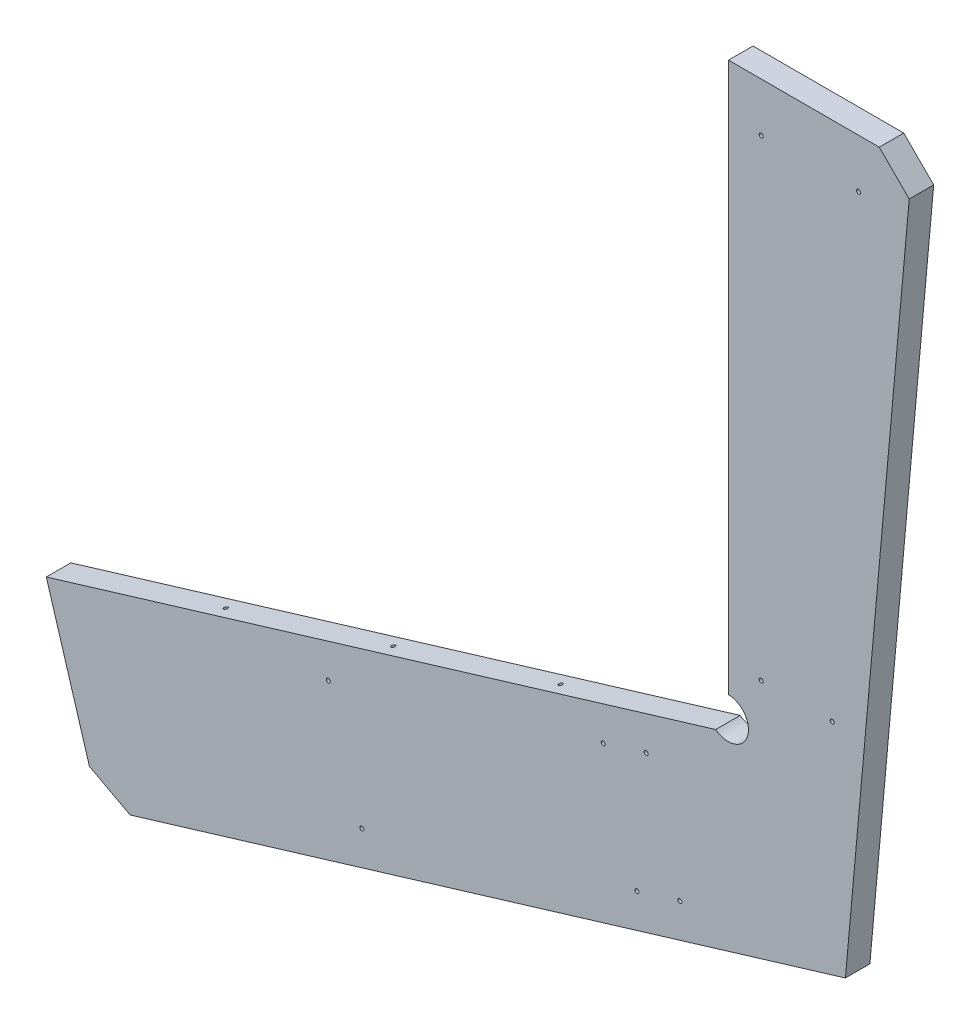
from build123d import *
from OCP.BRepFilletAPI import BRepFilletAPI_MakeChamfer

# Parameters (mm, degrees)
BOSS_EXTRUDE1_DEPTH = 19.05
CHAMFER1_SIZE       = 25.4
CHAMFER1_SIZE2      = 23.3906272
HOLE2_D             = 3.175
HOLE2_DEPTH         = 31.75
HOLE2_CSINK_D       = 10.16
HOLE2_CSINK_ANGLE   = 82
HOLE2_TIP           = 0.953866233
HOLE4_D             = 3.175
HOLE4_DEPTH         = 31.75
HOLE4_CSINK_D       = 10.16
HOLE4_CSINK_ANGLE   = 82
HOLE4_TIP           = 0.953866233
HOLE5_D             = 3.175
HOLE5_DEPTH         = 38.1
HOLE5_CSINK_D       = 10.16
HOLE5_CSINK_ANGLE   = 82
HOLE5_TIP           = 0.953866233
HOLE6_D             = 3.175
HOLE6_DEPTH         = 38.1
HOLE6_CSINK_D       = 10.16
HOLE6_CSINK_ANGLE   = 82
HOLE6_TIP           = 0.953866233


with BuildPart() as part:
    # Sketch1 → Boss-Extrude1 (new body)
    with BuildSketch(Plane.XY):
        with BuildLine():
            Line((12.7, 12.7), (12.7, -415.185594934))
            ThreePointArc((12.7, -415.185594934), (27.339445595, -436.32629993), (2.687239133, -443.641454859))
            Line((2.687239133, -443.641454859), (-518.461959982, -601.369999539))
            Line((-518.461959982, -601.369999539), (-477.533889468, -736.6))
            Line((-477.533889468, -736.6), (103.700681611, -560.686301639))
            Line((103.700681611, -560.686301639), (155.492294041, 12.7))
            Line((155.492294041, 12.7), (12.7, 12.7))
        make_face()
    extrude(amount=-BOSS_EXTRUDE1_DEPTH)

    # Chamfer1: one chamfer whose edges measure the first distance from different faces: ONE call of the kernel's chamfer builder (chamfer() names one face for all edges)
    chamfer1_edges_1 = [part.edges().sort_by_distance(p)[0] for p in [
        (-477.533889468, -736.6, -9.525),
    ]]
    chamfer1_edges_2 = [part.edges().sort_by_distance(p)[0] for p in [
        (155.492294041, 12.7, -9.525),
    ]]
    chamfer1_side_2 = [part.faces().sort_by_distance(p)[0] for p in [
        (84.09614702, 12.7, -9.525),
    ]]
    chamfer1 = BRepFilletAPI_MakeChamfer(part.part.solid().wrapped)
    for e in chamfer1_edges_1:
        chamfer1.Add(CHAMFER1_SIZE, e.wrapped)
    for e in chamfer1_edges_2:
        chamfer1.Add(CHAMFER1_SIZE, CHAMFER1_SIZE2, e.wrapped, chamfer1_side_2[0].wrapped)  # the first distance lies on this face
    add(Compound.cast(chamfer1.Shape()), mode=Mode.REPLACE)

    # Hole2
    with Locations(Plane(origin=(0, 10.424290059, 165.474999994), x_dir=(0, 0, -1), z_dir=(-1, 0, 0))):
        with Locations((-155.949999994, 107.734820482), (155.949999994, 107.734820482), (155.949999994, 327.755881328), (174.999999994, 85.732714397), (174.999999994, 349.757987412), (-174.999999994, 349.757987412), (-174.999999994, 85.732714397), (-155.949999994, 327.755881328)):
            CounterSinkHole(HOLE2_D / 2, HOLE2_CSINK_D / 2, depth=HOLE2_DEPTH, counter_sink_angle=HOLE2_CSINK_ANGLE)
            with Locations((0, 0, -(HOLE2_DEPTH + HOLE2_TIP / 2))):  # 118° drill point
                Cone(0, HOLE2_D / 2, HOLE2_TIP, mode=Mode.SUBTRACT)

    # Hole4
    with Locations(Plane(origin=(264.696145853, -351.07416346, 165.474999994), x_dir=(0, 0, -1), z_dir=(-0.2896786029738453, 0.9571239768071436, 8.258871730585588e-15))):
        with Locations((174.999999994, 685.961004241), (174.999999994, 549.837259632), (174.999999994, 413.713515022), (81.549999997, 779.649723129), (81.549999997, 652.344645962), (62.499999997, 662.953402392), (62.499999997, 769.040966698), (-62.499999997, 769.040966698), (-62.499999997, 662.953402392), (-81.549999997, 652.344645962), (-81.549999997, 779.649723129), (-174.999999994, 413.713515022), (-174.999999994, 549.837259632), (-174.999999994, 685.961004241), (-82.737499997, 600.384620239), (0, 600.384620239), (82.737499997, 600.384620239), (0, 376.737770337), (-82.737499997, 376.737770337), (82.737499997, 376.737770337)):
            CounterSinkHole(HOLE4_D / 2, HOLE4_CSINK_D / 2, depth=HOLE4_DEPTH, counter_sink_angle=HOLE4_CSINK_ANGLE)
            with Locations((0, 0, -(HOLE4_DEPTH + HOLE4_TIP / 2))):  # 118° drill point
                Cone(0, HOLE4_D / 2, HOLE4_TIP, mode=Mode.SUBTRACT)

    # Hole5
    with Locations(Plane(origin=(155.286738577, 10.424290059, -19.05), x_dir=(-0.08995962873759064, -0.9959454127598535, 0), z_dir=(0, 0, -1))):
        with Locations((46.221112845, 113.488854888), (39.39759596, 37.945520226), (412.28786892, 80.423559293), (407.308516105, 25.297013484), (513.561319184, 161.164706775), (597.46020397, 127.267357003), (610.543339245, 159.649253123), (694.322923815, 367.011001477), (526.644454459, 193.546602895), (610.424039029, 400.908351249)):
            CounterSinkHole(HOLE5_D / 2, HOLE5_CSINK_D / 2, depth=HOLE5_DEPTH, counter_sink_angle=HOLE5_CSINK_ANGLE)
            with Locations((0, 0, -(HOLE5_DEPTH + HOLE5_TIP / 2))):  # 118° drill point
                Cone(0, HOLE5_D / 2, HOLE5_TIP, mode=Mode.SUBTRACT)

    # Hole6
    with Locations(Plane(origin=(-643.705760022, -231.394989772, 165.474999994), x_dir=(0, 0, -1), z_dir=(-0.9571239768071421, -0.2896786029738502, -1.2569443472852944e-15))):
        with Locations((-108.649999997, 332.89193461), (108.649999997, 332.89193461), (207.774999994, 332.89193461), (174.999999994, 448.336332751), (135.266666663, 384.042401694), (176.283333328, 384.042401694), (-174.999999994, 448.336332751), (-135.266666663, 384.042401694), (-176.283333328, 384.042401694), (-207.774999994, 332.89193461)):
            CounterSinkHole(HOLE6_D / 2, HOLE6_CSINK_D / 2, depth=HOLE6_DEPTH, counter_sink_angle=HOLE6_CSINK_ANGLE)
            with Locations((0, 0, -(HOLE6_DEPTH + HOLE6_TIP / 2))):  # 118° drill point
                Cone(0, HOLE6_D / 2, HOLE6_TIP, mode=Mode.SUBTRACT)


solid = part.part
